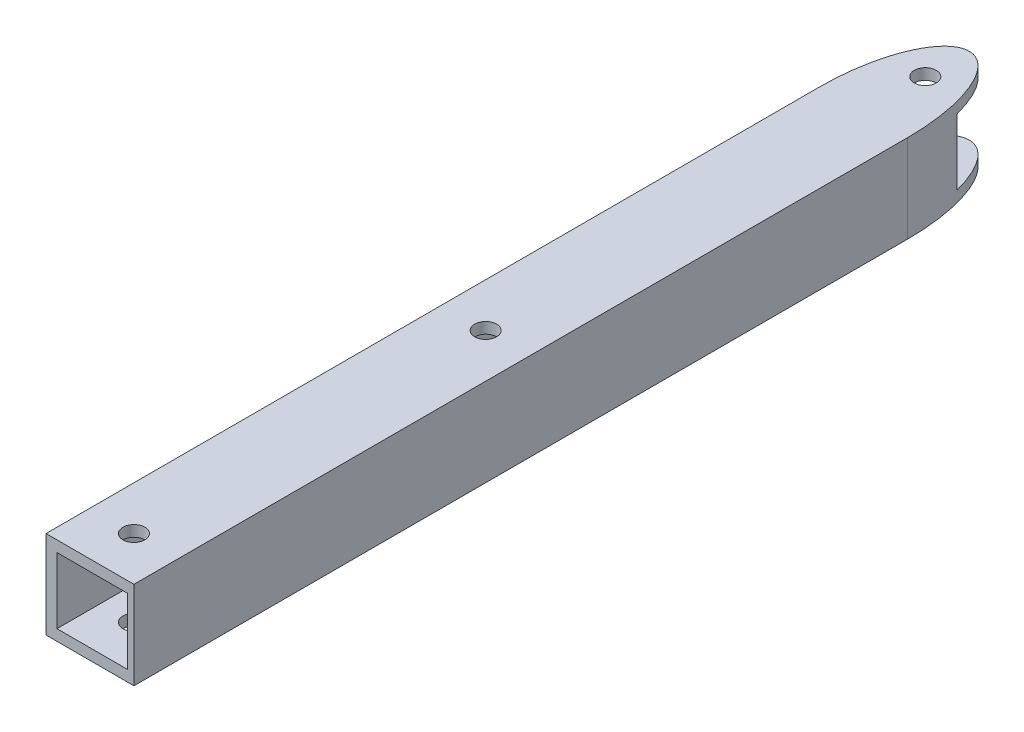
from build123d import *

# Parameters (mm, degrees)
SKETCH1_W           = 25.4
SKETCH1_H           = 25.4
BOSS_EXTRUDE2_DEPTH = 254
SKETCH2_W           = 20.302766191
SKETCH2_H           = 19.05
CUT_EXTRUDE1_DEPTH  = 257.527425434
CUT_EXTRUDE2_DEPTH  = 257.527425434
SKETCH6_R           = 3.175
CUT_EXTRUDE5_DEPTH  = 257.527425553
SKETCH4_R           = 3.175
CUT_EXTRUDE6_DEPTH  = 257.527425553
SKETCH7_R           = 3.175
CUT_EXTRUDE7_DEPTH  = 257.527425553


with BuildPart() as part:
    # Sketch1 → Boss-Extrude2 (new body)
    with BuildSketch(Plane.XY):
        with Locations((12.7, 12.7)):
            Rectangle(SKETCH1_W, SKETCH1_H)
    extrude(amount=BOSS_EXTRUDE2_DEPTH)

    # Sketch2 → Cut-Extrude1 (cut, through all)
    with BuildSketch(Plane(origin=(0, 0, 0), x_dir=(-1, 0, 0), z_dir=(0, 0, -1))):
        with Locations((-13.326383096, 12.7)):
            Rectangle(SKETCH2_W, SKETCH2_H)
    extrude(amount=-CUT_EXTRUDE1_DEPTH, mode=Mode.SUBTRACT)

    # Sketch3 → Cut-Extrude2 (cut, through all)
    with BuildSketch(Plane(origin=(0, 25.4, 0), x_dir=(1, 0, 0), z_dir=(0, 1, 0))):
        with BuildLine():
            add(Edge.make_bspline(
                [(12.7, 0), (0, 0), (0, -30.465860076)],
                knots=[6.283185307, 6.283185307, 6.283185307, 7.853981634, 7.853981634, 7.853981634], degree=2, weights=[1, 0.707106781, 1]))
            Line((12.7, 0), (0, 0))
            Line((0, 0), (0, -30.465860076))
        make_face()
        with BuildLine():
            Line((25.4, 0), (12.7, 0))
            add(Edge.make_bspline(
                [(25.4, -30.465860076), (25.4, 0), (12.7, 0)],
                knots=[4.71238898, 4.71238898, 4.71238898, 6.283185307, 6.283185307, 6.283185307], degree=2, weights=[1, 0.707106781, 1]))
            Line((25.4, -30.465860076), (25.4, 0))
        make_face()
    extrude(amount=-CUT_EXTRUDE2_DEPTH, mode=Mode.SUBTRACT)

    # Sketch6 → Cut-Extrude5 (cut, through all)
    with BuildSketch(Plane(origin=(0, 25.4, 0), x_dir=(1, 0, 0), z_dir=(0, 1, 0))):
        with Locations((12.7, -12.7)):
            Circle(SKETCH6_R)
    extrude(amount=-CUT_EXTRUDE5_DEPTH, mode=Mode.SUBTRACT)

    # Sketch4 → Cut-Extrude6 (cut, through all)
    with BuildSketch(Plane(origin=(0, 25.4, 0), x_dir=(1, 0, 0), z_dir=(0, 1, 0))):
        with Locations((12.7, -139.7)):
            Circle(SKETCH4_R)
    extrude(amount=-CUT_EXTRUDE6_DEPTH, mode=Mode.SUBTRACT)

    # Sketch7 → Cut-Extrude7 (cut, through all)
    with BuildSketch(Plane(origin=(0, 25.4, 0), x_dir=(1, 0, 0), z_dir=(0, 1, 0))):
        with Locations((12.7, -241.3)):
            Circle(SKETCH7_R)
    extrude(amount=-CUT_EXTRUDE7_DEPTH, mode=Mode.SUBTRACT)


solid = part.part
